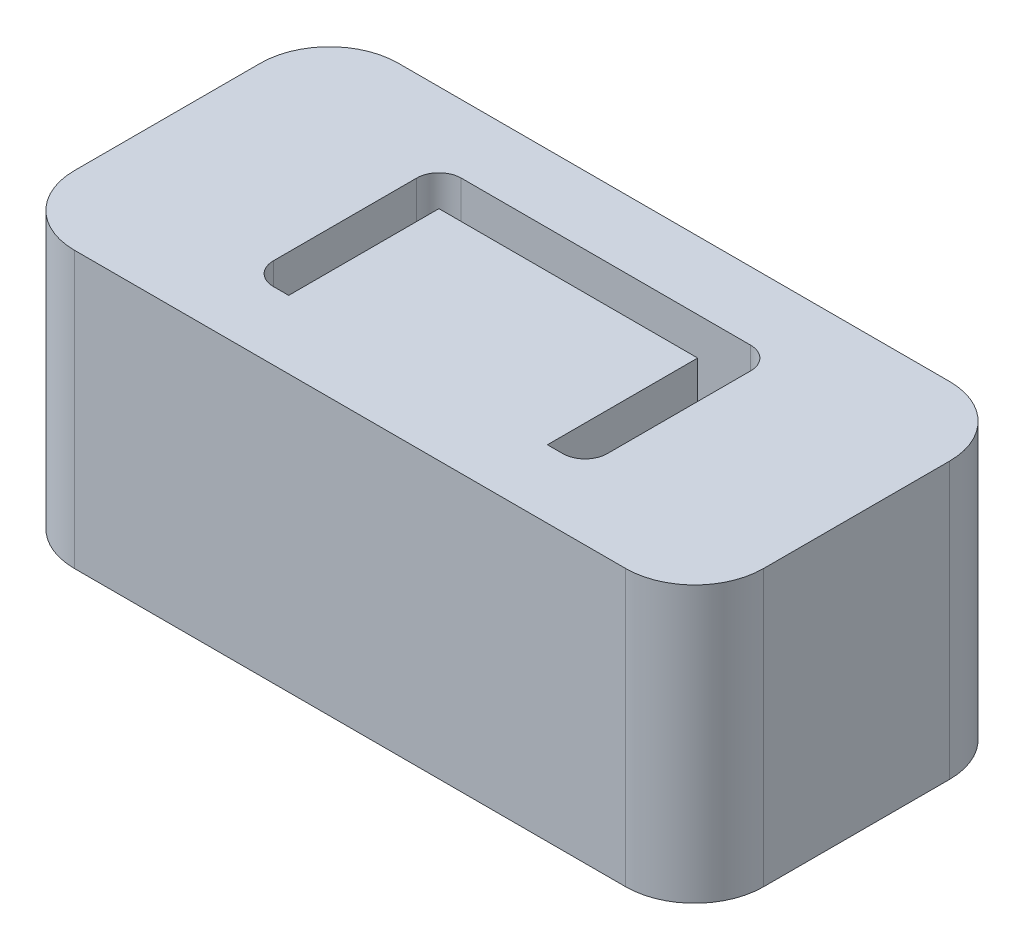
from build123d import *

# Parameters (mm, degrees)
SKETCH2_W                   = 100
SKETCH2_H                   = 47
BOSS_EXTRUDE1_DEPTH         = 40
FILLET1_R                   = 10
CUT_EXTRUDE1_REACH          = 70.207
M6_TAPPED_HOLE1_D           = 5
M6_TAPPED_HOLE1_DEPTH       = 17
M6_TAPPED_HOLE1_CSINK_D     = 6.05
M6_TAPPED_HOLE1_CSINK_ANGLE = 90
M6_TAPPED_HOLE1_TIP         = 1.502151548


with BuildPart() as part:
    # Sketch2 → Boss-Extrude1 (new body)
    with BuildSketch(Plane(origin=(0, 0, 0), x_dir=(1, 0, 0), z_dir=(0, 1, 0))):
        Rectangle(SKETCH2_W, SKETCH2_H)
    extrude(amount=-BOSS_EXTRUDE1_DEPTH)

    # Fillet1
    fillet1_edges = [part.edges().sort_by_distance(p)[0] for p in [
        (-50, -20, -23.5),
        (50, -20, -23.5),
        (50, -20, 23.5),
        (-50, -20, 23.5),
    ]]
    fillet(fillet1_edges, radius=FILLET1_R)

    # Sketch3 → Cut-Extrude1 (cut, up to next)
    with BuildSketch(Plane(origin=(0, 0, 0), x_dir=(1, 0, 0), z_dir=(0, 1, 0)), mode=Mode.PRIVATE) as cut_extrude1_sk1:
        with BuildLine():
            Line((24.23, -10.4), (24.23, 10.4))
            ThreePointArc((24.23, 10.4), (23.283954903, 12.683954903), (21, 13.63))
            Line((21, 13.63), (-21, 13.63))
            ThreePointArc((-21, 13.63), (-23.283954903, 12.683954903), (-24.23, 10.4))
            Line((-24.23, 10.4), (-24.23, -10.4))
            ThreePointArc((-24.23, -10.4), (-23.283954903, -12.683954903), (-21, -13.63))
            Line((-21, -13.63), (-18.77, -13.63))
            Line((-18.77, -13.63), (-18.77, 8.17))
            Line((-18.77, 8.17), (18.77, 8.17))
            Line((18.77, 8.17), (18.77, -13.63))
            Line((18.77, -13.63), (21, -13.63))
            ThreePointArc((21, -13.63), (23.283954903, -12.683954903), (24.23, -10.4))
        make_face()
    cut_extrude1_tool1 = extrude(cut_extrude1_sk1.sketch, amount=-CUT_EXTRUDE1_REACH, mode=Mode.PRIVATE) & part.part
    add(cut_extrude1_tool1.solids().sort_by_distance((-19.885, 0, 13.073989))[0], mode=Mode.SUBTRACT)

    # M6 Tapped Hole1
    with Locations(Plane(origin=(0, -40, 0), x_dir=(-1, 0, 0), z_dir=(0, -1, 0))):
        with Locations((-43, 16.5), (43, 16.5), (43, -16.5), (-43, -16.5)):
            CounterSinkHole(M6_TAPPED_HOLE1_D / 2, M6_TAPPED_HOLE1_CSINK_D / 2, depth=M6_TAPPED_HOLE1_DEPTH, counter_sink_angle=M6_TAPPED_HOLE1_CSINK_ANGLE)
            with Locations((0, 0, -(M6_TAPPED_HOLE1_DEPTH + M6_TAPPED_HOLE1_TIP / 2))):  # 118° drill point
                Cone(0, M6_TAPPED_HOLE1_D / 2, M6_TAPPED_HOLE1_TIP, mode=Mode.SUBTRACT)


solid = part.part
